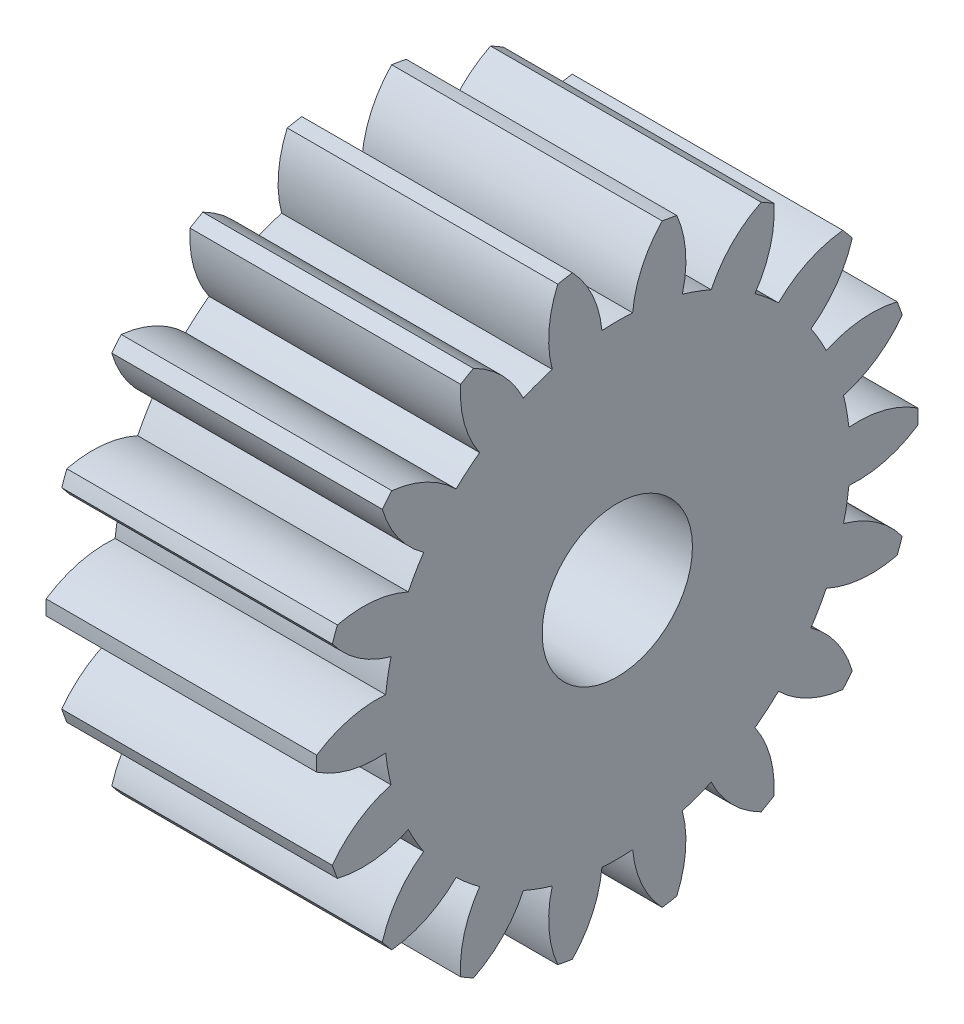
from build123d import *

# Parameters (mm, degrees)
SPUR_START             = -5.123248026
SPUR_GEAR_AM_OUTLINE_R = 2.5
SPUR_GEAR_AM_DEPTH     = 6
SKETCH9_R              = 2.5
BOSS_EXTRUDE1_DEPTH    = 3


# Read off the part's stored shape, not the designer's step: spur gear_am
with BuildPart() as part:
    # spur gear_am outline → spur gear_am (new body)
    with BuildSketch(Plane.YZ.offset(SPUR_START)):
        with BuildLine():
            ThreePointArc((7.586194163, 9.54321535), (7.39961576, 9.703727004), (7.209143639, 9.859598305))
            ThreePointArc((7.209143639, 9.859598305), (6.128209094, 9.33514268), (5.280046523, 8.484205876))
            ThreePointArc((5.280046523, 8.484205876), (4.846239663, 8.754113426), (4.395589438, 8.994847412))
            ThreePointArc((4.395589438, 8.994847412), (4.708441041, 10.154846148), (4.622165664, 11.353190736))
            ThreePointArc((4.622165664, 11.353190736), (4.391941096, 11.44020878), (4.159644725, 11.52153459))
            ThreePointArc((4.159644725, 11.52153459), (3.323272898, 10.659006121), (2.817298316, 9.569298401))
            ThreePointArc((2.817298316, 9.569298401), (2.317339392, 9.67455785), (1.811530828, 9.746642346))
            ThreePointArc((1.811530828, 9.746642346), (1.708772237, 10.943686148), (1.217841914, 12.040253798))
            ThreePointArc((1.217841914, 12.040253798), (0.971739663, 12.043282572), (0.725637412, 12.040253798))
            ThreePointArc((0.725637412, 12.040253798), (0.234707088, 10.943686148), (0.131948498, 9.746642346))
            ThreePointArc((0.131948498, 9.746642346), (-0.373860066, 9.67455785), (-0.87381899, 9.569298401))
            ThreePointArc((-0.87381899, 9.569298401), (-1.379793572, 10.659006121), (-2.216165399, 11.52153459))
            ThreePointArc((-2.216165399, 11.52153459), (-2.44846177, 11.44020878), (-2.678686338, 11.353190736))
            ThreePointArc((-2.678686338, 11.353190736), (-2.764961716, 10.154846148), (-2.452110112, 8.994847412))
            ThreePointArc((-2.452110112, 8.994847412), (-2.902760337, 8.754113426), (-3.336567197, 8.484205876))
            ThreePointArc((-3.336567197, 8.484205876), (-4.184729769, 9.33514268), (-5.265664313, 9.859598305))
            ThreePointArc((-5.265664313, 9.859598305), (-5.456136434, 9.703727004), (-5.642714837, 9.54321535))
            ThreePointArc((-5.642714837, 9.54321535), (-5.313929185, 8.387631866), (-4.623201908, 7.404591164))
            ThreePointArc((-4.623201908, 7.404591164), (-4.964338727, 7.02424376), (-5.279670013, 6.622242942))
            ThreePointArc((-5.279670013, 6.622242942), (-6.367719651, 7.131773293), (-7.562840254, 7.254898987))
            ThreePointArc((-7.562840254, 7.254898987), (-7.688514375, 7.043282572), (-7.808942505, 6.828637384))
            ThreePointArc((-7.808942505, 6.828637384), (-7.104752225, 5.855195427), (-6.119461178, 5.167681976))
            ThreePointArc((-6.119461178, 5.167681976), (-6.309938456, 4.693596663), (-6.468760561, 4.207989809))
            ThreePointArc((-6.468760561, 4.207989809), (-7.66546242, 4.314656828), (-8.830619899, 4.021601813))
            ThreePointArc((-8.830619899, 4.021601813), (-8.876337867, 3.779764349), (-8.916090314, 3.536875003))
            ThreePointArc((-8.916090314, 3.536875003), (-7.921431147, 2.86298604), (-6.760416972, 2.553924109))
            ThreePointArc((-6.760416972, 2.553924109), (-6.777260337, 2.043282572), (-6.760416972, 1.532641036))
            ThreePointArc((-6.760416972, 1.532641036), (-7.921431147, 1.223579105), (-8.916090314, 0.549690142))
            ThreePointArc((-8.916090314, 0.549690142), (-8.876337867, 0.306800796), (-8.830619899, 0.064963332))
            ThreePointArc((-8.830619899, 0.064963332), (-7.66546242, -0.228091683), (-6.468760561, -0.121424665))
            ThreePointArc((-6.468760561, -0.121424665), (-6.309938456, -0.607031518), (-6.119461178, -1.081116831))
            ThreePointArc((-6.119461178, -1.081116831), (-7.104752225, -1.768630282), (-7.808942505, -2.742072239))
            ThreePointArc((-7.808942505, -2.742072239), (-7.688514375, -2.956717428), (-7.562840254, -3.168333842))
            ThreePointArc((-7.562840254, -3.168333842), (-6.36771965, -3.045208149), (-5.279670013, -2.535677797))
            ThreePointArc((-5.279670013, -2.535677797), (-4.964338727, -2.937678615), (-4.623201908, -3.31802602))
            ThreePointArc((-4.623201908, -3.31802602), (-5.313929185, -4.301066721), (-5.642714837, -5.456650205))
            ThreePointArc((-5.642714837, -5.456650205), (-5.456136434, -5.617161859), (-5.265664313, -5.773033161))
            ThreePointArc((-5.265664313, -5.773033161), (-4.184729769, -5.248577535), (-3.336567197, -4.397640731))
            ThreePointArc((-3.336567197, -4.397640731), (-2.902760337, -4.667548282), (-2.452110112, -4.908282267))
            ThreePointArc((-2.452110112, -4.908282267), (-2.764961716, -6.068281003), (-2.678686338, -7.266625591))
            ThreePointArc((-2.678686338, -7.266625591), (-2.44846177, -7.353643635), (-2.216165399, -7.434969446))
            ThreePointArc((-2.216165399, -7.434969446), (-1.379793572, -6.572440977), (-0.87381899, -5.482733257))
            ThreePointArc((-0.87381899, -5.482733257), (-0.373860066, -5.587992706), (0.131948498, -5.660077201))
            ThreePointArc((0.131948498, -5.660077201), (0.234707088, -6.857121003), (0.725637412, -7.953688653))
            ThreePointArc((0.725637412, -7.953688653), (0.971739663, -7.956717428), (1.217841914, -7.953688653))
            ThreePointArc((1.217841914, -7.953688653), (1.708772237, -6.857121003), (1.811530828, -5.660077201))
            ThreePointArc((1.811530828, -5.660077201), (2.317339392, -5.587992706), (2.817298316, -5.482733257))
            ThreePointArc((2.817298316, -5.482733257), (3.323272898, -6.572440977), (4.159644725, -7.434969446))
            ThreePointArc((4.159644725, -7.434969446), (4.391941096, -7.353643635), (4.622165664, -7.266625591))
            ThreePointArc((4.622165664, -7.266625591), (4.708441041, -6.068281003), (4.395589438, -4.908282267))
            ThreePointArc((4.395589438, -4.908282267), (4.846239663, -4.667548282), (5.280046523, -4.397640731))
            ThreePointArc((5.280046523, -4.397640731), (6.128209095, -5.248577535), (7.209143639, -5.773033161))
            ThreePointArc((7.209143639, -5.773033161), (7.39961576, -5.617161859), (7.586194163, -5.456650205))
            ThreePointArc((7.586194163, -5.456650205), (7.257408511, -4.301066721), (6.566681234, -3.31802602))
            ThreePointArc((6.566681234, -3.31802602), (6.907818053, -2.937678615), (7.223149338, -2.535677797))
            ThreePointArc((7.223149338, -2.535677797), (8.311198976, -3.045208149), (9.506319579, -3.168333842))
            ThreePointArc((9.506319579, -3.168333842), (9.631993701, -2.956717428), (9.752421831, -2.742072239))
            ThreePointArc((9.752421831, -2.742072239), (9.048231551, -1.768630282), (8.062940504, -1.081116831))
            ThreePointArc((8.062940504, -1.081116831), (8.253417781, -0.607031518), (8.412239886, -0.121424665))
            ThreePointArc((8.412239886, -0.121424665), (9.608941746, -0.228091683), (10.774099225, 0.064963332))
            ThreePointArc((10.774099225, 0.064963332), (10.819817193, 0.306800796), (10.85956964, 0.549690142))
            ThreePointArc((10.85956964, 0.549690142), (9.864910473, 1.223579105), (8.703896297, 1.532641036))
            ThreePointArc((8.703896297, 1.532641036), (8.720739663, 2.043282572), (8.703896297, 2.553924109))
            ThreePointArc((8.703896297, 2.553924109), (9.864910473, 2.86298604), (10.85956964, 3.536875003))
            ThreePointArc((10.85956964, 3.536875003), (10.819817193, 3.779764349), (10.774099225, 4.021601813))
            ThreePointArc((10.774099225, 4.021601813), (9.608941746, 4.314656828), (8.412239886, 4.207989809))
            ThreePointArc((8.412239886, 4.207989809), (8.253417781, 4.693596663), (8.062940504, 5.167681976))
            ThreePointArc((8.062940504, 5.167681976), (9.048231551, 5.855195427), (9.752421831, 6.828637384))
            ThreePointArc((9.752421831, 6.828637384), (9.631993701, 7.043282573), (9.506319579, 7.254898987))
            ThreePointArc((9.506319579, 7.254898987), (8.311198976, 7.131773293), (7.223149338, 6.622242942))
            ThreePointArc((7.223149338, 6.622242942), (6.907818053, 7.02424376), (6.566681234, 7.404591164))
            ThreePointArc((6.566681234, 7.404591164), (7.257408511, 8.387631866), (7.586194163, 9.54321535))
        make_face()
        with Locations((0.971739663, 2.043282572)):
            Circle(SPUR_GEAR_AM_OUTLINE_R, mode=Mode.SUBTRACT)
    extrude(amount=SPUR_GEAR_AM_DEPTH)

    # Sketch9 → Boss-Extrude1 (add)
    with BuildSketch(Plane(origin=(0.876751974, 0.971739663, 2.043282572), x_dir=(0, 0, -1), z_dir=(1, 0, 0))):
        with BuildLine():
            ThreePointArc((-7.816315733, 6.237403976), (-7.291860108, 5.156469432), (-6.440923303, 4.30830686))
            ThreePointArc((-6.440923303, 4.30830686), (-6.710830854, 3.8745), (-6.95156484, 3.423849775))
            ThreePointArc((-6.95156484, 3.423849775), (-8.111563575, 3.736701378), (-9.309908163, 3.650426001))
            ThreePointArc((-9.309908163, 3.650426001), (-9.396926208, 3.420201433), (-9.478252018, 3.187905062))
            ThreePointArc((-9.478252018, 3.187905062), (-8.615723549, 2.351533235), (-7.526015829, 1.845558653))
            ThreePointArc((-7.526015829, 1.845558653), (-7.631275278, 1.345599729), (-7.703359773, 0.839791165))
            ThreePointArc((-7.703359773, 0.839791165), (-8.900403576, 0.737032575), (-9.996971225, 0.246102251))
            ThreePointArc((-9.996971225, 0.246102251), (-10, 0), (-9.996971225, -0.246102251))
            ThreePointArc((-9.996971225, -0.246102251), (-8.900403576, -0.737032575), (-7.703359773, -0.839791165))
            ThreePointArc((-7.703359773, -0.839791165), (-7.631275278, -1.345599729), (-7.526015829, -1.845558653))
            ThreePointArc((-7.526015829, -1.845558653), (-8.615723549, -2.351533235), (-9.478252018, -3.187905062))
            ThreePointArc((-9.478252018, -3.187905062), (-9.396926208, -3.420201433), (-9.309908163, -3.650426001))
            ThreePointArc((-9.309908163, -3.650426001), (-8.111563575, -3.736701378), (-6.95156484, -3.423849775))
            ThreePointArc((-6.95156484, -3.423849775), (-6.710830854, -3.8745), (-6.440923303, -4.30830686))
            ThreePointArc((-6.440923303, -4.30830686), (-7.291860108, -5.156469432), (-7.816315733, -6.237403976))
            ThreePointArc((-7.816315733, -6.237403976), (-7.660444431, -6.427876097), (-7.499932777, -6.6144545))
            ThreePointArc((-7.499932777, -6.6144545), (-6.344349294, -6.285668848), (-5.361308592, -5.594941571))
            ThreePointArc((-5.361308592, -5.594941571), (-4.980961187, -5.93607839), (-4.57896037, -6.251409676))
            ThreePointArc((-4.57896037, -6.251409676), (-5.088490721, -7.339459313), (-5.211616414, -8.534579916))
            ThreePointArc((-5.211616414, -8.534579916), (-5, -8.660254038), (-4.785354811, -8.780682168))
            ThreePointArc((-4.785354811, -8.780682168), (-3.811912855, -8.076491888), (-3.124399404, -7.091200841))
            ThreePointArc((-3.124399404, -7.091200841), (-2.650314091, -7.281678118), (-2.164707237, -7.440500224))
            ThreePointArc((-2.164707237, -7.440500224), (-2.271374255, -8.637202083), (-1.978319241, -9.802359562))
            ThreePointArc((-1.978319241, -9.802359562), (-1.736481777, -9.84807753), (-1.49359243, -9.887829977))
            ThreePointArc((-1.49359243, -9.887829977), (-0.819703468, -8.89317081), (-0.510641536, -7.732156635))
            ThreePointArc((-0.510641536, -7.732156635), (0, -7.749), (0.510641536, -7.732156635))
            ThreePointArc((0.510641536, -7.732156635), (0.819703468, -8.89317081), (1.49359243, -9.887829977))
            ThreePointArc((1.49359243, -9.887829977), (1.736481777, -9.84807753), (1.978319241, -9.802359562))
            ThreePointArc((1.978319241, -9.802359562), (2.271374255, -8.637202083), (2.164707237, -7.440500224))
            ThreePointArc((2.164707237, -7.440500224), (2.650314091, -7.281678118), (3.124399404, -7.091200841))
            ThreePointArc((3.124399404, -7.091200841), (3.811912855, -8.076491888), (4.785354811, -8.780682168))
            ThreePointArc((4.785354811, -8.780682168), (5, -8.660254038), (5.211616414, -8.534579916))
            ThreePointArc((5.211616414, -8.534579916), (5.088490721, -7.339459313), (4.57896037, -6.251409676))
            ThreePointArc((4.57896037, -6.251409676), (4.980961187, -5.93607839), (5.361308592, -5.594941571))
            ThreePointArc((5.361308592, -5.594941571), (6.344349294, -6.285668848), (7.499932777, -6.6144545))
            ThreePointArc((7.499932777, -6.6144545), (7.660444431, -6.427876097), (7.816315733, -6.237403976))
            ThreePointArc((7.816315733, -6.237403976), (7.291860108, -5.156469432), (6.440923303, -4.30830686))
            ThreePointArc((6.440923303, -4.30830686), (6.710830854, -3.8745), (6.95156484, -3.423849775))
            ThreePointArc((6.95156484, -3.423849775), (8.111563575, -3.736701378), (9.309908163, -3.650426001))
            ThreePointArc((9.309908163, -3.650426001), (9.396926208, -3.420201433), (9.478252018, -3.187905062))
            ThreePointArc((9.478252018, -3.187905062), (8.615723549, -2.351533235), (7.526015829, -1.845558653))
            ThreePointArc((7.526015829, -1.845558653), (7.631275278, -1.345599729), (7.703359773, -0.839791165))
            ThreePointArc((7.703359773, -0.839791165), (8.900403576, -0.737032575), (9.996971225, -0.246102251))
            ThreePointArc((9.996971225, -0.246102251), (10, 0), (9.996971225, 0.246102251))
            ThreePointArc((9.996971225, 0.246102251), (8.900403576, 0.737032575), (7.703359773, 0.839791165))
            ThreePointArc((7.703359773, 0.839791165), (7.631275278, 1.345599729), (7.526015829, 1.845558653))
            ThreePointArc((7.526015829, 1.845558653), (8.615723549, 2.351533235), (9.478252018, 3.187905062))
            ThreePointArc((9.478252018, 3.187905062), (9.396926208, 3.420201433), (9.309908163, 3.650426001))
            ThreePointArc((9.309908163, 3.650426001), (8.111563575, 3.736701378), (6.95156484, 3.423849775))
            ThreePointArc((6.95156484, 3.423849775), (6.710830854, 3.8745), (6.440923303, 4.30830686))
            ThreePointArc((6.440923303, 4.30830686), (7.291860108, 5.156469432), (7.816315733, 6.237403976))
            ThreePointArc((7.816315733, 6.237403976), (7.660444431, 6.427876097), (7.499932777, 6.6144545))
            ThreePointArc((7.499932777, 6.6144545), (6.344349294, 6.285668848), (5.361308592, 5.594941571))
            ThreePointArc((5.361308592, 5.594941571), (4.980961187, 5.93607839), (4.57896037, 6.251409676))
            ThreePointArc((4.57896037, 6.251409676), (5.088490721, 7.339459313), (5.211616414, 8.534579916))
            ThreePointArc((5.211616414, 8.534579916), (5, 8.660254038), (4.785354811, 8.780682168))
            ThreePointArc((4.785354811, 8.780682168), (3.811912855, 8.076491888), (3.124399404, 7.091200841))
            ThreePointArc((3.124399404, 7.091200841), (2.650314091, 7.281678118), (2.164707237, 7.440500224))
            ThreePointArc((2.164707237, 7.440500224), (2.271374255, 8.637202083), (1.978319241, 9.802359562))
            ThreePointArc((1.978319241, 9.802359562), (1.736481777, 9.84807753), (1.49359243, 9.887829977))
            ThreePointArc((1.49359243, 9.887829977), (0.819703468, 8.89317081), (0.510641536, 7.732156635))
            ThreePointArc((0.510641536, 7.732156635), (0, 7.749), (-0.510641536, 7.732156635))
            ThreePointArc((-0.510641536, 7.732156635), (-0.819703468, 8.89317081), (-1.49359243, 9.887829977))
            ThreePointArc((-1.49359243, 9.887829977), (-1.736481777, 9.84807753), (-1.978319241, 9.802359562))
            ThreePointArc((-1.978319241, 9.802359562), (-2.271374255, 8.637202083), (-2.164707237, 7.440500224))
            ThreePointArc((-2.164707237, 7.440500224), (-2.650314091, 7.281678118), (-3.124399404, 7.091200841))
            ThreePointArc((-3.124399404, 7.091200841), (-3.811912855, 8.076491888), (-4.785354811, 8.780682168))
            ThreePointArc((-4.785354811, 8.780682168), (-5, 8.660254038), (-5.211616414, 8.534579916))
            ThreePointArc((-5.211616414, 8.534579916), (-5.088490721, 7.339459313), (-4.57896037, 6.251409676))
            ThreePointArc((-4.57896037, 6.251409676), (-4.980961187, 5.93607839), (-5.361308592, 5.594941571))
            ThreePointArc((-5.361308592, 5.594941571), (-6.344349294, 6.285668848), (-7.499932777, 6.6144545))
            ThreePointArc((-7.499932777, 6.6144545), (-7.660444431, 6.427876097), (-7.816315733, 6.237403976))
        make_face()
        Circle(SKETCH9_R, mode=Mode.SUBTRACT)
    extrude(amount=BOSS_EXTRUDE1_DEPTH)


solid = part.part
